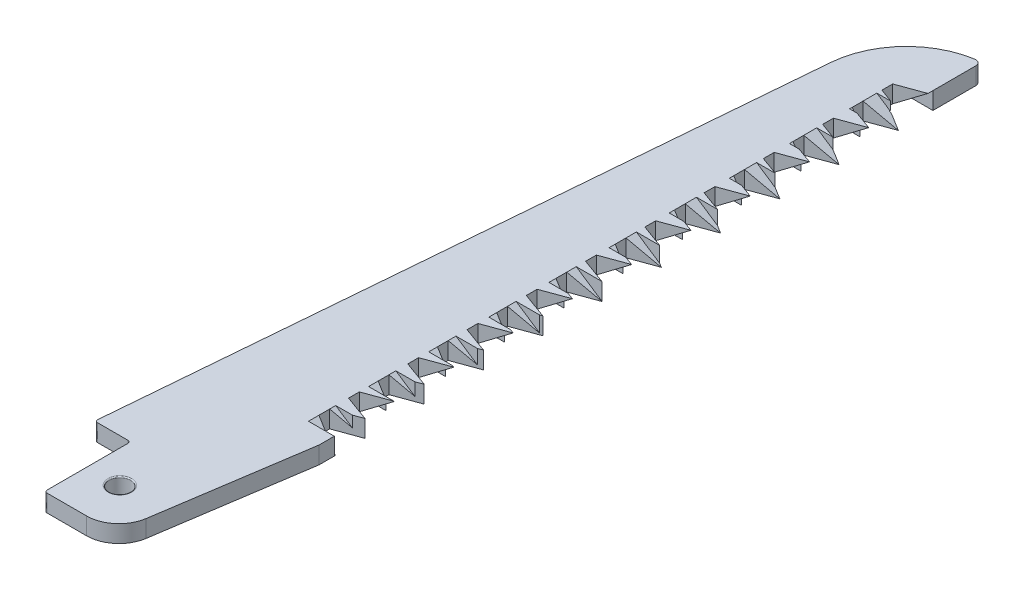
from build123d import *

# Parameters (mm, degrees)
SKETCH1_R              = 1
BOSS_EXTRUDE1_DEPTH    = 1.6
SKETCH2_W              = 3.5
SKETCH2_H              = 8
CUT_EXTRUDE1_DEPTH     = 80.011454866
FILLET1_R              = 3
FILLET3_R              = 0.1
FILLET4_R              = 0.25
CUT_EXTRUDE2_DEPTH     = 80.011454866
LPATTERN1_COUNT        = 20
LPATTERN1_PITCH        = 2.75
FILLET5_R              = 0.5
CUT_EXTRUDE3_START     = 5.602471982
CUT_EXTRUDE3_OUTLINE_W = 6
CUT_EXTRUDE3_OUTLINE_H = 2.84
CUT_EXTRUDE3_DEPTH     = 1.331280471
CUT_EXTRUDE4_REACH     = 81.346
SKETCH7_W              = 2.53
SKETCH7_H              = 4


with BuildPart() as part:
    # Sketch1 → Boss-Extrude1 (new body)
    with BuildSketch(Plane(origin=(0, 0, 0), x_dir=(1, 0, 0), z_dir=(0, 1, 0))):
        with BuildLine():
            Line((0, 0), (0, 6))
            Line((0, 6), (5.5, 71))
            ThreePointArc((5.5, 71), (7.72044875, 75.77955125), (12.5, 78))
            Line((12.5, 78), (12.5, 16.5))
            Line((12.5, 16.5), (10, 0))
            Line((10, 0), (0, 0))
        make_face()
        with Locations(Location((6.5, 4, 0), (0, 0, 270))):
            Circle(SKETCH1_R, mode=Mode.SUBTRACT)
    extrude(amount=BOSS_EXTRUDE1_DEPTH)

    # Sketch2 → Cut-Extrude1 (cut, through all)
    with BuildSketch(Plane(origin=(0, 1.6, 0), x_dir=(1, 0, 0), z_dir=(0, 1, 0))):
        with Locations((1.75, 4)):
            Rectangle(SKETCH2_W, SKETCH2_H)
    extrude(amount=-CUT_EXTRUDE1_DEPTH, mode=Mode.SUBTRACT)

    # Fillet1
    fillet1_edges = [part.edges().sort_by_distance(p)[0] for p in [
        (10, 0.8, 0),
    ]]
    fillet(fillet1_edges, radius=FILLET1_R)

    # Fillet3
    fillet3_edges = [part.edges().sort_by_distance(p)[0] for p in [
        (6.5, 0, -5),
        (6.5, 1.6, -5),
    ]]
    fillet(fillet3_edges, radius=FILLET3_R)

    # Fillet4
    fillet4_edges = [part.edges().sort_by_distance(p)[0] for p in [
        (0.169230769, 0.8, -8),
        (3.5, 0.8, -8),
        (3.5, 0.8, 0),
    ]]
    fillet(fillet4_edges, radius=FILLET4_R)

    # Sketch3 → Cut-Extrude2 (cut, through all)
    with BuildSketch(Plane(origin=(0, 1.6, 0), x_dir=(1, 0, 0), z_dir=(0, 1, 0))):
        Polygon((12.5, 73), (10.1, 72.125), (10.1, 71.125), (12.5, 70.25), align=None)
    cut_extrude2 = extrude(amount=-CUT_EXTRUDE2_DEPTH, mode=Mode.SUBTRACT)

    # LPattern1: Cut-Extrude2 ×20
    with Locations(*[(0, 0, i * LPATTERN1_PITCH) for i in range(1, LPATTERN1_COUNT)]):
        add(cut_extrude2, mode=Mode.SUBTRACT)

    # Fillet5
    fillet5_edges = [part.edges().sort_by_distance(p)[0] for p in [
        (12.5, 0.8, -78),
    ]]
    fillet(fillet5_edges, radius=FILLET5_R)

    # Cut-Extrude3: read off the stored shape, not the designer's step
    # Cut-Extrude3 outline → Cut-Extrude3 (cut)
    with BuildSketch(Plane(origin=(0, 0, 0), x_dir=(0.8320502943378438, 0.5547001962252289, 0), z_dir=(0.5547001962252289, -0.8320502943378438, 0)).offset(CUT_EXTRUDE3_START)):
        with Locations((10, -22.535035801)):
            Rectangle(CUT_EXTRUDE3_OUTLINE_W, CUT_EXTRUDE3_OUTLINE_H)
        with Locations((10, -28.035035801)):
            Rectangle(CUT_EXTRUDE3_OUTLINE_W, CUT_EXTRUDE3_OUTLINE_H)
        with Locations((10, -33.535035801)):
            Rectangle(CUT_EXTRUDE3_OUTLINE_W, CUT_EXTRUDE3_OUTLINE_H)
        with Locations((10, -39.035035801)):
            Rectangle(CUT_EXTRUDE3_OUTLINE_W, CUT_EXTRUDE3_OUTLINE_H)
        with Locations((10, -44.535035801)):
            Rectangle(CUT_EXTRUDE3_OUTLINE_W, CUT_EXTRUDE3_OUTLINE_H)
        with Locations((10, -50.035035801)):
            Rectangle(CUT_EXTRUDE3_OUTLINE_W, CUT_EXTRUDE3_OUTLINE_H)
        with Locations((10, -55.535035801)):
            Rectangle(CUT_EXTRUDE3_OUTLINE_W, CUT_EXTRUDE3_OUTLINE_H)
        with Locations((10, -61.035035801)):
            Rectangle(CUT_EXTRUDE3_OUTLINE_W, CUT_EXTRUDE3_OUTLINE_H)
        with Locations((10, -66.535035801)):
            Rectangle(CUT_EXTRUDE3_OUTLINE_W, CUT_EXTRUDE3_OUTLINE_H)
        with Locations((10, -72.035035801)):
            Rectangle(CUT_EXTRUDE3_OUTLINE_W, CUT_EXTRUDE3_OUTLINE_H)
    extrude(amount=CUT_EXTRUDE3_DEPTH, mode=Mode.SUBTRACT)

    # Cut-Extrude4: up to this plane
    cut_extrude4_end = Plane(origin=(10.1, 1.6, 0), z_dir=(0.5547001962252291, 0.8320502943378437, 0))
    # Sketch7 → Cut-Extrude4 (cut, up to the surface)
    with BuildSketch(Plane(origin=(15, 0, 0), x_dir=(0, 0, -1), z_dir=(1, 0, 0)), mode=Mode.PRIVATE) as cut_extrude4_sk1:
        with Locations((69.390035801, 0.6)):
            Rectangle(SKETCH7_W, SKETCH7_H)
    cut_extrude4_tool1 = split(extrude(cut_extrude4_sk1.sketch, amount=-CUT_EXTRUDE4_REACH, mode=Mode.PRIVATE), bisect_by=cut_extrude4_end, keep=Keep.BOTH, mode=Mode.PRIVATE)
    add(cut_extrude4_tool1.solids().sort_by_distance((15, 0.6, -69.390036))[0], mode=Mode.SUBTRACT)
    # Sketch7 → Cut-Extrude4 (cut, up to the surface)
    with BuildSketch(Plane(origin=(15, 0, 0), x_dir=(0, 0, -1), z_dir=(1, 0, 0)), mode=Mode.PRIVATE) as cut_extrude4_sk2:
        with Locations((63.810035801, 0.6)):
            Rectangle(SKETCH7_W, SKETCH7_H)
    cut_extrude4_tool2 = split(extrude(cut_extrude4_sk2.sketch, amount=-CUT_EXTRUDE4_REACH, mode=Mode.PRIVATE), bisect_by=cut_extrude4_end, keep=Keep.BOTH, mode=Mode.PRIVATE)
    add(cut_extrude4_tool2.solids().sort_by_distance((15, 0.6, -63.810036))[0], mode=Mode.SUBTRACT)
    # Sketch7 → Cut-Extrude4 (cut, up to the surface)
    with BuildSketch(Plane(origin=(15, 0, 0), x_dir=(0, 0, -1), z_dir=(1, 0, 0)), mode=Mode.PRIVATE) as cut_extrude4_sk3:
        with Locations((58.230035801, 0.6)):
            Rectangle(SKETCH7_W, SKETCH7_H)
    cut_extrude4_tool3 = split(extrude(cut_extrude4_sk3.sketch, amount=-CUT_EXTRUDE4_REACH, mode=Mode.PRIVATE), bisect_by=cut_extrude4_end, keep=Keep.BOTH, mode=Mode.PRIVATE)
    add(cut_extrude4_tool3.solids().sort_by_distance((15, 0.6, -58.230036))[0], mode=Mode.SUBTRACT)
    # Sketch7 → Cut-Extrude4 (cut, up to the surface)
    with BuildSketch(Plane(origin=(15, 0, 0), x_dir=(0, 0, -1), z_dir=(1, 0, 0)), mode=Mode.PRIVATE) as cut_extrude4_sk4:
        with Locations((52.650035801, 0.6)):
            Rectangle(SKETCH7_W, SKETCH7_H)
    cut_extrude4_tool4 = split(extrude(cut_extrude4_sk4.sketch, amount=-CUT_EXTRUDE4_REACH, mode=Mode.PRIVATE), bisect_by=cut_extrude4_end, keep=Keep.BOTH, mode=Mode.PRIVATE)
    add(cut_extrude4_tool4.solids().sort_by_distance((15, 0.6, -52.650036))[0], mode=Mode.SUBTRACT)
    # Sketch7 → Cut-Extrude4 (cut, up to the surface)
    with BuildSketch(Plane(origin=(15, 0, 0), x_dir=(0, 0, -1), z_dir=(1, 0, 0)), mode=Mode.PRIVATE) as cut_extrude4_sk5:
        with Locations((47.070035801, 0.6)):
            Rectangle(SKETCH7_W, SKETCH7_H)
    cut_extrude4_tool5 = split(extrude(cut_extrude4_sk5.sketch, amount=-CUT_EXTRUDE4_REACH, mode=Mode.PRIVATE), bisect_by=cut_extrude4_end, keep=Keep.BOTH, mode=Mode.PRIVATE)
    add(cut_extrude4_tool5.solids().sort_by_distance((15, 0.6, -47.070036))[0], mode=Mode.SUBTRACT)
    # Sketch7 → Cut-Extrude4 (cut, up to the surface)
    with BuildSketch(Plane(origin=(15, 0, 0), x_dir=(0, 0, -1), z_dir=(1, 0, 0)), mode=Mode.PRIVATE) as cut_extrude4_sk6:
        with Locations((41.490035801, 0.6)):
            Rectangle(SKETCH7_W, SKETCH7_H)
    cut_extrude4_tool6 = split(extrude(cut_extrude4_sk6.sketch, amount=-CUT_EXTRUDE4_REACH, mode=Mode.PRIVATE), bisect_by=cut_extrude4_end, keep=Keep.BOTH, mode=Mode.PRIVATE)
    add(cut_extrude4_tool6.solids().sort_by_distance((15, 0.6, -41.490036))[0], mode=Mode.SUBTRACT)
    # Sketch7 → Cut-Extrude4 (cut, up to the surface)
    with BuildSketch(Plane(origin=(15, 0, 0), x_dir=(0, 0, -1), z_dir=(1, 0, 0)), mode=Mode.PRIVATE) as cut_extrude4_sk7:
        with Locations((35.910035801, 0.6)):
            Rectangle(SKETCH7_W, SKETCH7_H)
    cut_extrude4_tool7 = split(extrude(cut_extrude4_sk7.sketch, amount=-CUT_EXTRUDE4_REACH, mode=Mode.PRIVATE), bisect_by=cut_extrude4_end, keep=Keep.BOTH, mode=Mode.PRIVATE)
    add(cut_extrude4_tool7.solids().sort_by_distance((15, 0.6, -35.910036))[0], mode=Mode.SUBTRACT)
    # Sketch7 → Cut-Extrude4 (cut, up to the surface)
    with BuildSketch(Plane(origin=(15, 0, 0), x_dir=(0, 0, -1), z_dir=(1, 0, 0)), mode=Mode.PRIVATE) as cut_extrude4_sk8:
        with Locations((30.330035801, 0.6)):
            Rectangle(SKETCH7_W, SKETCH7_H)
    cut_extrude4_tool8 = split(extrude(cut_extrude4_sk8.sketch, amount=-CUT_EXTRUDE4_REACH, mode=Mode.PRIVATE), bisect_by=cut_extrude4_end, keep=Keep.BOTH, mode=Mode.PRIVATE)
    add(cut_extrude4_tool8.solids().sort_by_distance((15, 0.6, -30.330036))[0], mode=Mode.SUBTRACT)
    # Sketch7 → Cut-Extrude4 (cut, up to the surface)
    with BuildSketch(Plane(origin=(15, 0, 0), x_dir=(0, 0, -1), z_dir=(1, 0, 0)), mode=Mode.PRIVATE) as cut_extrude4_sk9:
        with Locations((24.750035801, 0.6)):
            Rectangle(SKETCH7_W, SKETCH7_H)
    cut_extrude4_tool9 = split(extrude(cut_extrude4_sk9.sketch, amount=-CUT_EXTRUDE4_REACH, mode=Mode.PRIVATE), bisect_by=cut_extrude4_end, keep=Keep.BOTH, mode=Mode.PRIVATE)
    add(cut_extrude4_tool9.solids().sort_by_distance((15, 0.6, -24.750036))[0], mode=Mode.SUBTRACT)
    # Sketch7 → Cut-Extrude4 (cut, up to the surface)
    with BuildSketch(Plane(origin=(15, 0, 0), x_dir=(0, 0, -1), z_dir=(1, 0, 0)), mode=Mode.PRIVATE) as cut_extrude4_sk10:
        with Locations((19.170035801, 0.6)):
            Rectangle(SKETCH7_W, SKETCH7_H)
    cut_extrude4_tool10 = split(extrude(cut_extrude4_sk10.sketch, amount=-CUT_EXTRUDE4_REACH, mode=Mode.PRIVATE), bisect_by=cut_extrude4_end, keep=Keep.BOTH, mode=Mode.PRIVATE)
    add(cut_extrude4_tool10.solids().sort_by_distance((15, 0.6, -19.170036))[0], mode=Mode.SUBTRACT)


solid = part.part
